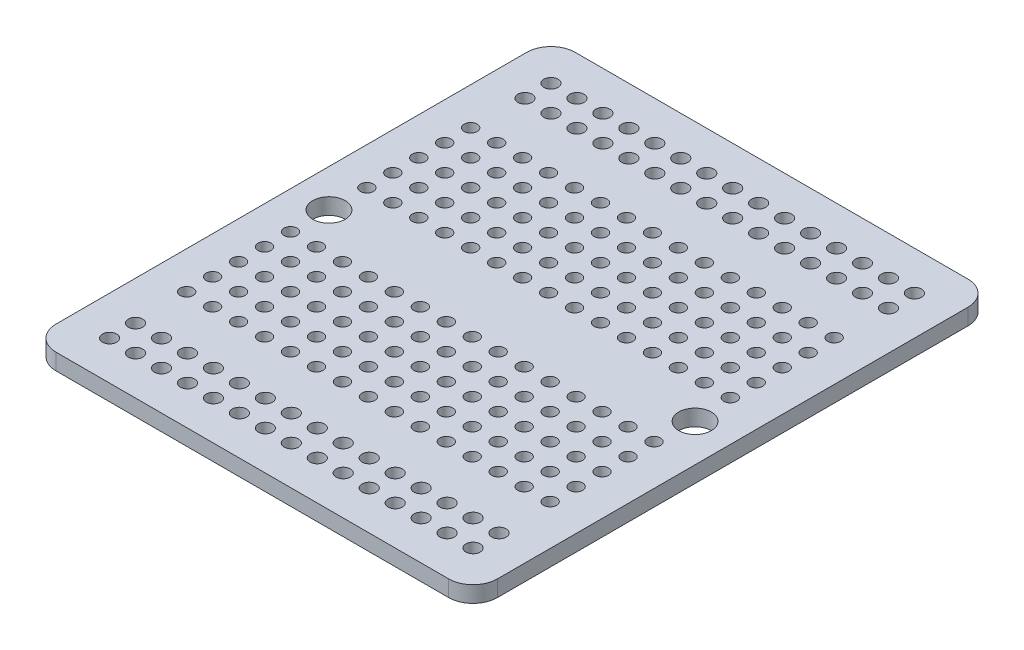
from build123d import *

# Parameters (mm, degrees)
SKETCH1_W                 = 43.18
SKETCH1_H                 = 50.8
BOSS_EXTRUDE1_DEPTH       = 1.5875
FILLET1_R                 = 2.38125
SKETCH4_R                 = 0.6985
CUT_EXTRUDE1_DEPTH        = 34.373765988
LPATTERN1_COUNT           = 15
LPATTERN1_PITCH           = 2.54
LPATTERN1_COUNT_DIR2      = 2
LPATTERN1_PITCH_DIR2      = 2.54
SKETCH5_R                 = 0.635
CUT_EXTRUDE6_DEPTH        = 34.373765988
LPATTERN2_COUNT           = 15
LPATTERN2_PITCH           = 2.54
LPATTERN2_COUNT_DIR2      = 5
LPATTERN2_PITCH_DIR2      = 2.54
MIRROR1_COPY_1_SKETCH_R   = 0.6985
MIRROR1_COPY_1_DEPTH      = 34.373765988
MIRROR1_COPY_2_SKETCH_R   = 0.6985
MIRROR1_COPY_2_DEPTH      = 34.373765988
MIRROR1_COPY_3_SKETCH_R   = 0.6985
MIRROR1_COPY_3_DEPTH      = 34.373765988
MIRROR1_COPY_4_SKETCH_R   = 0.6985
MIRROR1_COPY_4_DEPTH      = 34.373765988
MIRROR1_COPY_5_SKETCH_R   = 0.6985
MIRROR1_COPY_5_DEPTH      = 34.373765988
MIRROR1_COPY_6_SKETCH_R   = 0.6985
MIRROR1_COPY_6_DEPTH      = 34.373765988
MIRROR1_COPY_7_SKETCH_R   = 0.6985
MIRROR1_COPY_7_DEPTH      = 34.373765988
MIRROR1_COPY_8_SKETCH_R   = 0.6985
MIRROR1_COPY_8_DEPTH      = 34.373765988
MIRROR1_COPY_9_SKETCH_R   = 0.6985
MIRROR1_COPY_9_DEPTH      = 34.373765988
MIRROR1_COPY_10_SKETCH_R  = 0.6985
MIRROR1_COPY_10_DEPTH     = 34.373765988
MIRROR1_COPY_11_SKETCH_R  = 0.6985
MIRROR1_COPY_11_DEPTH     = 34.373765988
MIRROR1_COPY_12_SKETCH_R  = 0.6985
MIRROR1_COPY_12_DEPTH     = 34.373765988
MIRROR1_COPY_13_SKETCH_R  = 0.6985
MIRROR1_COPY_13_DEPTH     = 34.373765988
MIRROR1_COPY_14_SKETCH_R  = 0.6985
MIRROR1_COPY_14_DEPTH     = 34.373765988
MIRROR1_COPY_15_SKETCH_R  = 0.6985
MIRROR1_COPY_15_DEPTH     = 34.373765988
MIRROR1_COPY_16_SKETCH_R  = 0.6985
MIRROR1_COPY_16_DEPTH     = 34.373765988
MIRROR1_COPY_17_SKETCH_R  = 0.6985
MIRROR1_COPY_17_DEPTH     = 34.373765988
MIRROR1_COPY_18_SKETCH_R  = 0.6985
MIRROR1_COPY_18_DEPTH     = 34.373765988
MIRROR1_COPY_19_SKETCH_R  = 0.6985
MIRROR1_COPY_19_DEPTH     = 34.373765988
MIRROR1_COPY_20_SKETCH_R  = 0.6985
MIRROR1_COPY_20_DEPTH     = 34.373765988
MIRROR1_COPY_21_SKETCH_R  = 0.6985
MIRROR1_COPY_21_DEPTH     = 34.373765988
MIRROR1_COPY_22_SKETCH_R  = 0.6985
MIRROR1_COPY_22_DEPTH     = 34.373765988
MIRROR1_COPY_23_SKETCH_R  = 0.6985
MIRROR1_COPY_23_DEPTH     = 34.373765988
MIRROR1_COPY_24_SKETCH_R  = 0.6985
MIRROR1_COPY_24_DEPTH     = 34.373765988
MIRROR1_COPY_25_SKETCH_R  = 0.6985
MIRROR1_COPY_25_DEPTH     = 34.373765988
MIRROR1_COPY_26_SKETCH_R  = 0.6985
MIRROR1_COPY_26_DEPTH     = 34.373765988
MIRROR1_COPY_27_SKETCH_R  = 0.6985
MIRROR1_COPY_27_DEPTH     = 34.373765988
MIRROR1_COPY_28_SKETCH_R  = 0.6985
MIRROR1_COPY_28_DEPTH     = 34.373765988
MIRROR1_COPY_29_SKETCH_R  = 0.6985
MIRROR1_COPY_29_DEPTH     = 34.373765988
MIRROR1_COPY_30_SKETCH_R  = 0.635
MIRROR1_COPY_30_DEPTH     = 34.373765988
MIRROR1_COPY_31_SKETCH_R  = 0.635
MIRROR1_COPY_31_DEPTH     = 34.373765988
MIRROR1_COPY_32_SKETCH_R  = 0.635
MIRROR1_COPY_32_DEPTH     = 34.373765988
MIRROR1_COPY_33_SKETCH_R  = 0.635
MIRROR1_COPY_33_DEPTH     = 34.373765988
MIRROR1_COPY_34_SKETCH_R  = 0.635
MIRROR1_COPY_34_DEPTH     = 34.373765988
MIRROR1_COPY_35_SKETCH_R  = 0.635
MIRROR1_COPY_35_DEPTH     = 34.373765988
MIRROR1_COPY_36_SKETCH_R  = 0.635
MIRROR1_COPY_36_DEPTH     = 34.373765988
MIRROR1_COPY_37_SKETCH_R  = 0.635
MIRROR1_COPY_37_DEPTH     = 34.373765988
MIRROR1_COPY_38_SKETCH_R  = 0.635
MIRROR1_COPY_38_DEPTH     = 34.373765988
MIRROR1_COPY_39_SKETCH_R  = 0.635
MIRROR1_COPY_39_DEPTH     = 34.373765988
MIRROR1_COPY_40_SKETCH_R  = 0.635
MIRROR1_COPY_40_DEPTH     = 34.373765988
MIRROR1_COPY_41_SKETCH_R  = 0.635
MIRROR1_COPY_41_DEPTH     = 34.373765988
MIRROR1_COPY_42_SKETCH_R  = 0.635
MIRROR1_COPY_42_DEPTH     = 34.373765988
MIRROR1_COPY_43_SKETCH_R  = 0.635
MIRROR1_COPY_43_DEPTH     = 34.373765988
MIRROR1_COPY_44_SKETCH_R  = 0.635
MIRROR1_COPY_44_DEPTH     = 34.373765988
MIRROR1_COPY_45_SKETCH_R  = 0.635
MIRROR1_COPY_45_DEPTH     = 34.373765988
MIRROR1_COPY_46_SKETCH_R  = 0.635
MIRROR1_COPY_46_DEPTH     = 34.373765988
MIRROR1_COPY_47_SKETCH_R  = 0.635
MIRROR1_COPY_47_DEPTH     = 34.373765988
MIRROR1_COPY_48_SKETCH_R  = 0.635
MIRROR1_COPY_48_DEPTH     = 34.373765988
MIRROR1_COPY_49_SKETCH_R  = 0.635
MIRROR1_COPY_49_DEPTH     = 34.373765988
MIRROR1_COPY_50_SKETCH_R  = 0.635
MIRROR1_COPY_50_DEPTH     = 34.373765988
MIRROR1_COPY_51_SKETCH_R  = 0.635
MIRROR1_COPY_51_DEPTH     = 34.373765988
MIRROR1_COPY_52_SKETCH_R  = 0.635
MIRROR1_COPY_52_DEPTH     = 34.373765988
MIRROR1_COPY_53_SKETCH_R  = 0.635
MIRROR1_COPY_53_DEPTH     = 34.373765988
MIRROR1_COPY_54_SKETCH_R  = 0.635
MIRROR1_COPY_54_DEPTH     = 34.373765988
MIRROR1_COPY_55_SKETCH_R  = 0.635
MIRROR1_COPY_55_DEPTH     = 34.373765988
MIRROR1_COPY_56_SKETCH_R  = 0.635
MIRROR1_COPY_56_DEPTH     = 34.373765988
MIRROR1_COPY_57_SKETCH_R  = 0.635
MIRROR1_COPY_57_DEPTH     = 34.373765988
MIRROR1_COPY_58_SKETCH_R  = 0.635
MIRROR1_COPY_58_DEPTH     = 34.373765988
MIRROR1_COPY_59_SKETCH_R  = 0.635
MIRROR1_COPY_59_DEPTH     = 34.373765988
MIRROR1_COPY_60_SKETCH_R  = 0.635
MIRROR1_COPY_60_DEPTH     = 34.373765988
MIRROR1_COPY_61_SKETCH_R  = 0.635
MIRROR1_COPY_61_DEPTH     = 34.373765988
MIRROR1_COPY_62_SKETCH_R  = 0.635
MIRROR1_COPY_62_DEPTH     = 34.373765988
MIRROR1_COPY_63_SKETCH_R  = 0.635
MIRROR1_COPY_63_DEPTH     = 34.373765988
MIRROR1_COPY_64_SKETCH_R  = 0.635
MIRROR1_COPY_64_DEPTH     = 34.373765988
MIRROR1_COPY_65_SKETCH_R  = 0.635
MIRROR1_COPY_65_DEPTH     = 34.373765988
MIRROR1_COPY_66_SKETCH_R  = 0.635
MIRROR1_COPY_66_DEPTH     = 34.373765988
MIRROR1_COPY_67_SKETCH_R  = 0.635
MIRROR1_COPY_67_DEPTH     = 34.373765988
MIRROR1_COPY_68_SKETCH_R  = 0.635
MIRROR1_COPY_68_DEPTH     = 34.373765988
MIRROR1_COPY_69_SKETCH_R  = 0.635
MIRROR1_COPY_69_DEPTH     = 34.373765988
MIRROR1_COPY_70_SKETCH_R  = 0.635
MIRROR1_COPY_70_DEPTH     = 34.373765988
MIRROR1_COPY_71_SKETCH_R  = 0.635
MIRROR1_COPY_71_DEPTH     = 34.373765988
MIRROR1_COPY_72_SKETCH_R  = 0.635
MIRROR1_COPY_72_DEPTH     = 34.373765988
MIRROR1_COPY_73_SKETCH_R  = 0.635
MIRROR1_COPY_73_DEPTH     = 34.373765988
MIRROR1_COPY_74_SKETCH_R  = 0.635
MIRROR1_COPY_74_DEPTH     = 34.373765988
MIRROR1_COPY_75_SKETCH_R  = 0.635
MIRROR1_COPY_75_DEPTH     = 34.373765988
MIRROR1_COPY_76_SKETCH_R  = 0.635
MIRROR1_COPY_76_DEPTH     = 34.373765988
MIRROR1_COPY_77_SKETCH_R  = 0.635
MIRROR1_COPY_77_DEPTH     = 34.373765988
MIRROR1_COPY_78_SKETCH_R  = 0.635
MIRROR1_COPY_78_DEPTH     = 34.373765988
MIRROR1_COPY_79_SKETCH_R  = 0.635
MIRROR1_COPY_79_DEPTH     = 34.373765988
MIRROR1_COPY_80_SKETCH_R  = 0.635
MIRROR1_COPY_80_DEPTH     = 34.373765988
MIRROR1_COPY_81_SKETCH_R  = 0.635
MIRROR1_COPY_81_DEPTH     = 34.373765988
MIRROR1_COPY_82_SKETCH_R  = 0.635
MIRROR1_COPY_82_DEPTH     = 34.373765988
MIRROR1_COPY_83_SKETCH_R  = 0.635
MIRROR1_COPY_83_DEPTH     = 34.373765988
MIRROR1_COPY_84_SKETCH_R  = 0.635
MIRROR1_COPY_84_DEPTH     = 34.373765988
MIRROR1_COPY_85_SKETCH_R  = 0.635
MIRROR1_COPY_85_DEPTH     = 34.373765988
MIRROR1_COPY_86_SKETCH_R  = 0.635
MIRROR1_COPY_86_DEPTH     = 34.373765988
MIRROR1_COPY_87_SKETCH_R  = 0.635
MIRROR1_COPY_87_DEPTH     = 34.373765988
MIRROR1_COPY_88_SKETCH_R  = 0.635
MIRROR1_COPY_88_DEPTH     = 34.373765988
MIRROR1_COPY_89_SKETCH_R  = 0.635
MIRROR1_COPY_89_DEPTH     = 34.373765988
MIRROR1_COPY_90_SKETCH_R  = 0.635
MIRROR1_COPY_90_DEPTH     = 34.373765988
MIRROR1_COPY_91_SKETCH_R  = 0.635
MIRROR1_COPY_91_DEPTH     = 34.373765988
MIRROR1_COPY_92_SKETCH_R  = 0.635
MIRROR1_COPY_92_DEPTH     = 34.373765988
MIRROR1_COPY_93_SKETCH_R  = 0.635
MIRROR1_COPY_93_DEPTH     = 34.373765988
MIRROR1_COPY_94_SKETCH_R  = 0.635
MIRROR1_COPY_94_DEPTH     = 34.373765988
MIRROR1_COPY_95_SKETCH_R  = 0.635
MIRROR1_COPY_95_DEPTH     = 34.373765988
MIRROR1_COPY_96_SKETCH_R  = 0.635
MIRROR1_COPY_96_DEPTH     = 34.373765988
MIRROR1_COPY_97_SKETCH_R  = 0.635
MIRROR1_COPY_97_DEPTH     = 34.373765988
MIRROR1_COPY_98_SKETCH_R  = 0.635
MIRROR1_COPY_98_DEPTH     = 34.373765988
MIRROR1_COPY_99_SKETCH_R  = 0.635
MIRROR1_COPY_99_DEPTH     = 34.373765988
MIRROR1_COPY_100_SKETCH_R = 0.635
MIRROR1_COPY_100_DEPTH    = 34.373765988
MIRROR1_COPY_101_SKETCH_R = 0.635
MIRROR1_COPY_101_DEPTH    = 34.373765988
MIRROR1_COPY_102_SKETCH_R = 0.635
MIRROR1_COPY_102_DEPTH    = 34.373765988
MIRROR1_COPY_103_SKETCH_R = 0.635
MIRROR1_COPY_103_DEPTH    = 34.373765988
SKETCH6_R                 = 1.5875
CUT_EXTRUDE7_DEPTH        = 34.373765988


with BuildPart() as part:
    # Sketch1 → Boss-Extrude1 (new body)
    with BuildSketch(Plane(origin=(0, 0, 0), x_dir=(1, 0, 0), z_dir=(0, 1, 0))):
        Rectangle(SKETCH1_W, SKETCH1_H)
    extrude(amount=BOSS_EXTRUDE1_DEPTH)

    # Fillet1
    fillet1_edges = [part.edges().sort_by_distance(p)[0] for p in [
        (-21.59, 0.79375, 25.4),
        (-21.59, 0.79375, -25.4),
        (21.59, 0.79375, -25.4),
        (21.59, 0.79375, 25.4),
    ]]
    fillet(fillet1_edges, radius=FILLET1_R)

    # Sketch4 → Cut-Extrude1 (cut, through all)
    with BuildSketch(Plane(origin=(0, 1.5875, 0), x_dir=(1, 0, 0), z_dir=(0, 1, 0))):
        with Locations((-17.78, 21.59)):
            Circle(SKETCH4_R)
    cut_extrude1 = extrude(amount=-CUT_EXTRUDE1_DEPTH, mode=Mode.SUBTRACT)

    # LPattern1: Cut-Extrude1 15 × 2
    with Locations(*[(i * LPATTERN1_PITCH, 0, j * LPATTERN1_PITCH_DIR2) for i in range(LPATTERN1_COUNT) for j in range(LPATTERN1_COUNT_DIR2) if (i, j) != (0, 0)]):
        add(cut_extrude1, mode=Mode.SUBTRACT)

    # Sketch5 → Cut-Extrude6 (cut, through all)
    with BuildSketch(Plane(origin=(0, 0, 0), x_dir=(1, 0, 0), z_dir=(0, 1, 0))):
        with Locations((-17.935079329, 13.893307041)):
            Circle(SKETCH5_R)
    cut_extrude6 = extrude(amount=CUT_EXTRUDE6_DEPTH, mode=Mode.SUBTRACT)

    # LPattern2: Cut-Extrude6 15 × 5
    with Locations(*[(i * LPATTERN2_PITCH, 0, j * LPATTERN2_PITCH_DIR2) for i in range(LPATTERN2_COUNT) for j in range(LPATTERN2_COUNT_DIR2) if (i, j) != (0, 0)]):
        add(cut_extrude6, mode=Mode.SUBTRACT)

    # Mirror1: Cut-Extrude1, Cut-Extrude6 across plane
    add(cut_extrude1.mirror(Plane.XY), mode=Mode.SUBTRACT)
    add(cut_extrude6.mirror(Plane.XY), mode=Mode.SUBTRACT)

    # Mirror1 copy 1 sketch → Mirror1 copy 1 (cut, through all)
    with BuildSketch(Plane(origin=(0, 1.5875, -2.54), x_dir=(1, 0, 0), z_dir=(0, 1, 0))):
        with Locations((-17.78, -21.59)):
            Circle(MIRROR1_COPY_1_SKETCH_R)
    extrude(amount=-MIRROR1_COPY_1_DEPTH, mode=Mode.SUBTRACT)

    # Mirror1 copy 2 sketch → Mirror1 copy 2 (cut, through all)
    with BuildSketch(Plane(origin=(2.54, 1.5875, 0), x_dir=(1, 0, 0), z_dir=(0, 1, 0))):
        with Locations((-17.78, -21.59)):
            Circle(MIRROR1_COPY_2_SKETCH_R)
    extrude(amount=-MIRROR1_COPY_2_DEPTH, mode=Mode.SUBTRACT)

    # Mirror1 copy 3 sketch → Mirror1 copy 3 (cut, through all)
    with BuildSketch(Plane(origin=(2.54, 1.5875, -2.54), x_dir=(1, 0, 0), z_dir=(0, 1, 0))):
        with Locations((-17.78, -21.59)):
            Circle(MIRROR1_COPY_3_SKETCH_R)
    extrude(amount=-MIRROR1_COPY_3_DEPTH, mode=Mode.SUBTRACT)

    # Mirror1 copy 4 sketch → Mirror1 copy 4 (cut, through all)
    with BuildSketch(Plane(origin=(5.08, 1.5875, 0), x_dir=(1, 0, 0), z_dir=(0, 1, 0))):
        with Locations((-17.78, -21.59)):
            Circle(MIRROR1_COPY_4_SKETCH_R)
    extrude(amount=-MIRROR1_COPY_4_DEPTH, mode=Mode.SUBTRACT)

    # Mirror1 copy 5 sketch → Mirror1 copy 5 (cut, through all)
    with BuildSketch(Plane(origin=(5.08, 1.5875, -2.54), x_dir=(1, 0, 0), z_dir=(0, 1, 0))):
        with Locations((-17.78, -21.59)):
            Circle(MIRROR1_COPY_5_SKETCH_R)
    extrude(amount=-MIRROR1_COPY_5_DEPTH, mode=Mode.SUBTRACT)

    # Mirror1 copy 6 sketch → Mirror1 copy 6 (cut, through all)
    with BuildSketch(Plane(origin=(7.62, 1.5875, 0), x_dir=(1, 0, 0), z_dir=(0, 1, 0))):
        with Locations((-17.78, -21.59)):
            Circle(MIRROR1_COPY_6_SKETCH_R)
    extrude(amount=-MIRROR1_COPY_6_DEPTH, mode=Mode.SUBTRACT)

    # Mirror1 copy 7 sketch → Mirror1 copy 7 (cut, through all)
    with BuildSketch(Plane(origin=(7.62, 1.5875, -2.54), x_dir=(1, 0, 0), z_dir=(0, 1, 0))):
        with Locations((-17.78, -21.59)):
            Circle(MIRROR1_COPY_7_SKETCH_R)
    extrude(amount=-MIRROR1_COPY_7_DEPTH, mode=Mode.SUBTRACT)

    # Mirror1 copy 8 sketch → Mirror1 copy 8 (cut, through all)
    with BuildSketch(Plane(origin=(10.16, 1.5875, 0), x_dir=(1, 0, 0), z_dir=(0, 1, 0))):
        with Locations((-17.78, -21.59)):
            Circle(MIRROR1_COPY_8_SKETCH_R)
    extrude(amount=-MIRROR1_COPY_8_DEPTH, mode=Mode.SUBTRACT)

    # Mirror1 copy 9 sketch → Mirror1 copy 9 (cut, through all)
    with BuildSketch(Plane(origin=(10.16, 1.5875, -2.54), x_dir=(1, 0, 0), z_dir=(0, 1, 0))):
        with Locations((-17.78, -21.59)):
            Circle(MIRROR1_COPY_9_SKETCH_R)
    extrude(amount=-MIRROR1_COPY_9_DEPTH, mode=Mode.SUBTRACT)

    # Mirror1 copy 10 sketch → Mirror1 copy 10 (cut, through all)
    with BuildSketch(Plane(origin=(12.7, 1.5875, 0), x_dir=(1, 0, 0), z_dir=(0, 1, 0))):
        with Locations((-17.78, -21.59)):
            Circle(MIRROR1_COPY_10_SKETCH_R)
    extrude(amount=-MIRROR1_COPY_10_DEPTH, mode=Mode.SUBTRACT)

    # Mirror1 copy 11 sketch → Mirror1 copy 11 (cut, through all)
    with BuildSketch(Plane(origin=(12.7, 1.5875, -2.54), x_dir=(1, 0, 0), z_dir=(0, 1, 0))):
        with Locations((-17.78, -21.59)):
            Circle(MIRROR1_COPY_11_SKETCH_R)
    extrude(amount=-MIRROR1_COPY_11_DEPTH, mode=Mode.SUBTRACT)

    # Mirror1 copy 12 sketch → Mirror1 copy 12 (cut, through all)
    with BuildSketch(Plane(origin=(15.24, 1.5875, 0), x_dir=(1, 0, 0), z_dir=(0, 1, 0))):
        with Locations((-17.78, -21.59)):
            Circle(MIRROR1_COPY_12_SKETCH_R)
    extrude(amount=-MIRROR1_COPY_12_DEPTH, mode=Mode.SUBTRACT)

    # Mirror1 copy 13 sketch → Mirror1 copy 13 (cut, through all)
    with BuildSketch(Plane(origin=(15.24, 1.5875, -2.54), x_dir=(1, 0, 0), z_dir=(0, 1, 0))):
        with Locations((-17.78, -21.59)):
            Circle(MIRROR1_COPY_13_SKETCH_R)
    extrude(amount=-MIRROR1_COPY_13_DEPTH, mode=Mode.SUBTRACT)

    # Mirror1 copy 14 sketch → Mirror1 copy 14 (cut, through all)
    with BuildSketch(Plane(origin=(17.78, 1.5875, 0), x_dir=(1, 0, 0), z_dir=(0, 1, 0))):
        with Locations((-17.78, -21.59)):
            Circle(MIRROR1_COPY_14_SKETCH_R)
    extrude(amount=-MIRROR1_COPY_14_DEPTH, mode=Mode.SUBTRACT)

    # Mirror1 copy 15 sketch → Mirror1 copy 15 (cut, through all)
    with BuildSketch(Plane(origin=(17.78, 1.5875, -2.54), x_dir=(1, 0, 0), z_dir=(0, 1, 0))):
        with Locations((-17.78, -21.59)):
            Circle(MIRROR1_COPY_15_SKETCH_R)
    extrude(amount=-MIRROR1_COPY_15_DEPTH, mode=Mode.SUBTRACT)

    # Mirror1 copy 16 sketch → Mirror1 copy 16 (cut, through all)
    with BuildSketch(Plane(origin=(20.32, 1.5875, 0), x_dir=(1, 0, 0), z_dir=(0, 1, 0))):
        with Locations((-17.78, -21.59)):
            Circle(MIRROR1_COPY_16_SKETCH_R)
    extrude(amount=-MIRROR1_COPY_16_DEPTH, mode=Mode.SUBTRACT)

    # Mirror1 copy 17 sketch → Mirror1 copy 17 (cut, through all)
    with BuildSketch(Plane(origin=(20.32, 1.5875, -2.54), x_dir=(1, 0, 0), z_dir=(0, 1, 0))):
        with Locations((-17.78, -21.59)):
            Circle(MIRROR1_COPY_17_SKETCH_R)
    extrude(amount=-MIRROR1_COPY_17_DEPTH, mode=Mode.SUBTRACT)

    # Mirror1 copy 18 sketch → Mirror1 copy 18 (cut, through all)
    with BuildSketch(Plane(origin=(22.86, 1.5875, 0), x_dir=(1, 0, 0), z_dir=(0, 1, 0))):
        with Locations((-17.78, -21.59)):
            Circle(MIRROR1_COPY_18_SKETCH_R)
    extrude(amount=-MIRROR1_COPY_18_DEPTH, mode=Mode.SUBTRACT)

    # Mirror1 copy 19 sketch → Mirror1 copy 19 (cut, through all)
    with BuildSketch(Plane(origin=(22.86, 1.5875, -2.54), x_dir=(1, 0, 0), z_dir=(0, 1, 0))):
        with Locations((-17.78, -21.59)):
            Circle(MIRROR1_COPY_19_SKETCH_R)
    extrude(amount=-MIRROR1_COPY_19_DEPTH, mode=Mode.SUBTRACT)

    # Mirror1 copy 20 sketch → Mirror1 copy 20 (cut, through all)
    with BuildSketch(Plane(origin=(25.4, 1.5875, 0), x_dir=(1, 0, 0), z_dir=(0, 1, 0))):
        with Locations((-17.78, -21.59)):
            Circle(MIRROR1_COPY_20_SKETCH_R)
    extrude(amount=-MIRROR1_COPY_20_DEPTH, mode=Mode.SUBTRACT)

    # Mirror1 copy 21 sketch → Mirror1 copy 21 (cut, through all)
    with BuildSketch(Plane(origin=(25.4, 1.5875, -2.54), x_dir=(1, 0, 0), z_dir=(0, 1, 0))):
        with Locations((-17.78, -21.59)):
            Circle(MIRROR1_COPY_21_SKETCH_R)
    extrude(amount=-MIRROR1_COPY_21_DEPTH, mode=Mode.SUBTRACT)

    # Mirror1 copy 22 sketch → Mirror1 copy 22 (cut, through all)
    with BuildSketch(Plane(origin=(27.94, 1.5875, 0), x_dir=(1, 0, 0), z_dir=(0, 1, 0))):
        with Locations((-17.78, -21.59)):
            Circle(MIRROR1_COPY_22_SKETCH_R)
    extrude(amount=-MIRROR1_COPY_22_DEPTH, mode=Mode.SUBTRACT)

    # Mirror1 copy 23 sketch → Mirror1 copy 23 (cut, through all)
    with BuildSketch(Plane(origin=(27.94, 1.5875, -2.54), x_dir=(1, 0, 0), z_dir=(0, 1, 0))):
        with Locations((-17.78, -21.59)):
            Circle(MIRROR1_COPY_23_SKETCH_R)
    extrude(amount=-MIRROR1_COPY_23_DEPTH, mode=Mode.SUBTRACT)

    # Mirror1 copy 24 sketch → Mirror1 copy 24 (cut, through all)
    with BuildSketch(Plane(origin=(30.48, 1.5875, 0), x_dir=(1, 0, 0), z_dir=(0, 1, 0))):
        with Locations((-17.78, -21.59)):
            Circle(MIRROR1_COPY_24_SKETCH_R)
    extrude(amount=-MIRROR1_COPY_24_DEPTH, mode=Mode.SUBTRACT)

    # Mirror1 copy 25 sketch → Mirror1 copy 25 (cut, through all)
    with BuildSketch(Plane(origin=(30.48, 1.5875, -2.54), x_dir=(1, 0, 0), z_dir=(0, 1, 0))):
        with Locations((-17.78, -21.59)):
            Circle(MIRROR1_COPY_25_SKETCH_R)
    extrude(amount=-MIRROR1_COPY_25_DEPTH, mode=Mode.SUBTRACT)

    # Mirror1 copy 26 sketch → Mirror1 copy 26 (cut, through all)
    with BuildSketch(Plane(origin=(33.02, 1.5875, 0), x_dir=(1, 0, 0), z_dir=(0, 1, 0))):
        with Locations((-17.78, -21.59)):
            Circle(MIRROR1_COPY_26_SKETCH_R)
    extrude(amount=-MIRROR1_COPY_26_DEPTH, mode=Mode.SUBTRACT)

    # Mirror1 copy 27 sketch → Mirror1 copy 27 (cut, through all)
    with BuildSketch(Plane(origin=(33.02, 1.5875, -2.54), x_dir=(1, 0, 0), z_dir=(0, 1, 0))):
        with Locations((-17.78, -21.59)):
            Circle(MIRROR1_COPY_27_SKETCH_R)
    extrude(amount=-MIRROR1_COPY_27_DEPTH, mode=Mode.SUBTRACT)

    # Mirror1 copy 28 sketch → Mirror1 copy 28 (cut, through all)
    with BuildSketch(Plane(origin=(35.56, 1.5875, 0), x_dir=(1, 0, 0), z_dir=(0, 1, 0))):
        with Locations((-17.78, -21.59)):
            Circle(MIRROR1_COPY_28_SKETCH_R)
    extrude(amount=-MIRROR1_COPY_28_DEPTH, mode=Mode.SUBTRACT)

    # Mirror1 copy 29 sketch → Mirror1 copy 29 (cut, through all)
    with BuildSketch(Plane(origin=(35.56, 1.5875, -2.54), x_dir=(1, 0, 0), z_dir=(0, 1, 0))):
        with Locations((-17.78, -21.59)):
            Circle(MIRROR1_COPY_29_SKETCH_R)
    extrude(amount=-MIRROR1_COPY_29_DEPTH, mode=Mode.SUBTRACT)

    # Mirror1 copy 30 sketch → Mirror1 copy 30 (cut, through all)
    with BuildSketch(Plane(origin=(0, 0, -2.54), x_dir=(1, 0, 0), z_dir=(0, 1, 0))):
        with Locations((-17.935079329, -13.893307041)):
            Circle(MIRROR1_COPY_30_SKETCH_R)
    extrude(amount=MIRROR1_COPY_30_DEPTH, mode=Mode.SUBTRACT)

    # Mirror1 copy 31 sketch → Mirror1 copy 31 (cut, through all)
    with BuildSketch(Plane(origin=(0, 0, -5.08), x_dir=(1, 0, 0), z_dir=(0, 1, 0))):
        with Locations((-17.935079329, -13.893307041)):
            Circle(MIRROR1_COPY_31_SKETCH_R)
    extrude(amount=MIRROR1_COPY_31_DEPTH, mode=Mode.SUBTRACT)

    # Mirror1 copy 32 sketch → Mirror1 copy 32 (cut, through all)
    with BuildSketch(Plane(origin=(0, 0, -7.62), x_dir=(1, 0, 0), z_dir=(0, 1, 0))):
        with Locations((-17.935079329, -13.893307041)):
            Circle(MIRROR1_COPY_32_SKETCH_R)
    extrude(amount=MIRROR1_COPY_32_DEPTH, mode=Mode.SUBTRACT)

    # Mirror1 copy 33 sketch → Mirror1 copy 33 (cut, through all)
    with BuildSketch(Plane(origin=(0, 0, -10.16), x_dir=(1, 0, 0), z_dir=(0, 1, 0))):
        with Locations((-17.935079329, -13.893307041)):
            Circle(MIRROR1_COPY_33_SKETCH_R)
    extrude(amount=MIRROR1_COPY_33_DEPTH, mode=Mode.SUBTRACT)

    # Mirror1 copy 34 sketch → Mirror1 copy 34 (cut, through all)
    with BuildSketch(Plane(origin=(2.54, 0, 0), x_dir=(1, 0, 0), z_dir=(0, 1, 0))):
        with Locations((-17.935079329, -13.893307041)):
            Circle(MIRROR1_COPY_34_SKETCH_R)
    extrude(amount=MIRROR1_COPY_34_DEPTH, mode=Mode.SUBTRACT)

    # Mirror1 copy 35 sketch → Mirror1 copy 35 (cut, through all)
    with BuildSketch(Plane(origin=(2.54, 0, -2.54), x_dir=(1, 0, 0), z_dir=(0, 1, 0))):
        with Locations((-17.935079329, -13.893307041)):
            Circle(MIRROR1_COPY_35_SKETCH_R)
    extrude(amount=MIRROR1_COPY_35_DEPTH, mode=Mode.SUBTRACT)

    # Mirror1 copy 36 sketch → Mirror1 copy 36 (cut, through all)
    with BuildSketch(Plane(origin=(2.54, 0, -5.08), x_dir=(1, 0, 0), z_dir=(0, 1, 0))):
        with Locations((-17.935079329, -13.893307041)):
            Circle(MIRROR1_COPY_36_SKETCH_R)
    extrude(amount=MIRROR1_COPY_36_DEPTH, mode=Mode.SUBTRACT)

    # Mirror1 copy 37 sketch → Mirror1 copy 37 (cut, through all)
    with BuildSketch(Plane(origin=(2.54, 0, -7.62), x_dir=(1, 0, 0), z_dir=(0, 1, 0))):
        with Locations((-17.935079329, -13.893307041)):
            Circle(MIRROR1_COPY_37_SKETCH_R)
    extrude(amount=MIRROR1_COPY_37_DEPTH, mode=Mode.SUBTRACT)

    # Mirror1 copy 38 sketch → Mirror1 copy 38 (cut, through all)
    with BuildSketch(Plane(origin=(2.54, 0, -10.16), x_dir=(1, 0, 0), z_dir=(0, 1, 0))):
        with Locations((-17.935079329, -13.893307041)):
            Circle(MIRROR1_COPY_38_SKETCH_R)
    extrude(amount=MIRROR1_COPY_38_DEPTH, mode=Mode.SUBTRACT)

    # Mirror1 copy 39 sketch → Mirror1 copy 39 (cut, through all)
    with BuildSketch(Plane(origin=(5.08, 0, 0), x_dir=(1, 0, 0), z_dir=(0, 1, 0))):
        with Locations((-17.935079329, -13.893307041)):
            Circle(MIRROR1_COPY_39_SKETCH_R)
    extrude(amount=MIRROR1_COPY_39_DEPTH, mode=Mode.SUBTRACT)

    # Mirror1 copy 40 sketch → Mirror1 copy 40 (cut, through all)
    with BuildSketch(Plane(origin=(5.08, 0, -2.54), x_dir=(1, 0, 0), z_dir=(0, 1, 0))):
        with Locations((-17.935079329, -13.893307041)):
            Circle(MIRROR1_COPY_40_SKETCH_R)
    extrude(amount=MIRROR1_COPY_40_DEPTH, mode=Mode.SUBTRACT)

    # Mirror1 copy 41 sketch → Mirror1 copy 41 (cut, through all)
    with BuildSketch(Plane(origin=(5.08, 0, -5.08), x_dir=(1, 0, 0), z_dir=(0, 1, 0))):
        with Locations((-17.935079329, -13.893307041)):
            Circle(MIRROR1_COPY_41_SKETCH_R)
    extrude(amount=MIRROR1_COPY_41_DEPTH, mode=Mode.SUBTRACT)

    # Mirror1 copy 42 sketch → Mirror1 copy 42 (cut, through all)
    with BuildSketch(Plane(origin=(5.08, 0, -7.62), x_dir=(1, 0, 0), z_dir=(0, 1, 0))):
        with Locations((-17.935079329, -13.893307041)):
            Circle(MIRROR1_COPY_42_SKETCH_R)
    extrude(amount=MIRROR1_COPY_42_DEPTH, mode=Mode.SUBTRACT)

    # Mirror1 copy 43 sketch → Mirror1 copy 43 (cut, through all)
    with BuildSketch(Plane(origin=(5.08, 0, -10.16), x_dir=(1, 0, 0), z_dir=(0, 1, 0))):
        with Locations((-17.935079329, -13.893307041)):
            Circle(MIRROR1_COPY_43_SKETCH_R)
    extrude(amount=MIRROR1_COPY_43_DEPTH, mode=Mode.SUBTRACT)

    # Mirror1 copy 44 sketch → Mirror1 copy 44 (cut, through all)
    with BuildSketch(Plane(origin=(7.62, 0, 0), x_dir=(1, 0, 0), z_dir=(0, 1, 0))):
        with Locations((-17.935079329, -13.893307041)):
            Circle(MIRROR1_COPY_44_SKETCH_R)
    extrude(amount=MIRROR1_COPY_44_DEPTH, mode=Mode.SUBTRACT)

    # Mirror1 copy 45 sketch → Mirror1 copy 45 (cut, through all)
    with BuildSketch(Plane(origin=(7.62, 0, -2.54), x_dir=(1, 0, 0), z_dir=(0, 1, 0))):
        with Locations((-17.935079329, -13.893307041)):
            Circle(MIRROR1_COPY_45_SKETCH_R)
    extrude(amount=MIRROR1_COPY_45_DEPTH, mode=Mode.SUBTRACT)

    # Mirror1 copy 46 sketch → Mirror1 copy 46 (cut, through all)
    with BuildSketch(Plane(origin=(7.62, 0, -5.08), x_dir=(1, 0, 0), z_dir=(0, 1, 0))):
        with Locations((-17.935079329, -13.893307041)):
            Circle(MIRROR1_COPY_46_SKETCH_R)
    extrude(amount=MIRROR1_COPY_46_DEPTH, mode=Mode.SUBTRACT)

    # Mirror1 copy 47 sketch → Mirror1 copy 47 (cut, through all)
    with BuildSketch(Plane(origin=(7.62, 0, -7.62), x_dir=(1, 0, 0), z_dir=(0, 1, 0))):
        with Locations((-17.935079329, -13.893307041)):
            Circle(MIRROR1_COPY_47_SKETCH_R)
    extrude(amount=MIRROR1_COPY_47_DEPTH, mode=Mode.SUBTRACT)

    # Mirror1 copy 48 sketch → Mirror1 copy 48 (cut, through all)
    with BuildSketch(Plane(origin=(7.62, 0, -10.16), x_dir=(1, 0, 0), z_dir=(0, 1, 0))):
        with Locations((-17.935079329, -13.893307041)):
            Circle(MIRROR1_COPY_48_SKETCH_R)
    extrude(amount=MIRROR1_COPY_48_DEPTH, mode=Mode.SUBTRACT)

    # Mirror1 copy 49 sketch → Mirror1 copy 49 (cut, through all)
    with BuildSketch(Plane(origin=(10.16, 0, 0), x_dir=(1, 0, 0), z_dir=(0, 1, 0))):
        with Locations((-17.935079329, -13.893307041)):
            Circle(MIRROR1_COPY_49_SKETCH_R)
    extrude(amount=MIRROR1_COPY_49_DEPTH, mode=Mode.SUBTRACT)

    # Mirror1 copy 50 sketch → Mirror1 copy 50 (cut, through all)
    with BuildSketch(Plane(origin=(10.16, 0, -2.54), x_dir=(1, 0, 0), z_dir=(0, 1, 0))):
        with Locations((-17.935079329, -13.893307041)):
            Circle(MIRROR1_COPY_50_SKETCH_R)
    extrude(amount=MIRROR1_COPY_50_DEPTH, mode=Mode.SUBTRACT)

    # Mirror1 copy 51 sketch → Mirror1 copy 51 (cut, through all)
    with BuildSketch(Plane(origin=(10.16, 0, -5.08), x_dir=(1, 0, 0), z_dir=(0, 1, 0))):
        with Locations((-17.935079329, -13.893307041)):
            Circle(MIRROR1_COPY_51_SKETCH_R)
    extrude(amount=MIRROR1_COPY_51_DEPTH, mode=Mode.SUBTRACT)

    # Mirror1 copy 52 sketch → Mirror1 copy 52 (cut, through all)
    with BuildSketch(Plane(origin=(10.16, 0, -7.62), x_dir=(1, 0, 0), z_dir=(0, 1, 0))):
        with Locations((-17.935079329, -13.893307041)):
            Circle(MIRROR1_COPY_52_SKETCH_R)
    extrude(amount=MIRROR1_COPY_52_DEPTH, mode=Mode.SUBTRACT)

    # Mirror1 copy 53 sketch → Mirror1 copy 53 (cut, through all)
    with BuildSketch(Plane(origin=(10.16, 0, -10.16), x_dir=(1, 0, 0), z_dir=(0, 1, 0))):
        with Locations((-17.935079329, -13.893307041)):
            Circle(MIRROR1_COPY_53_SKETCH_R)
    extrude(amount=MIRROR1_COPY_53_DEPTH, mode=Mode.SUBTRACT)

    # Mirror1 copy 54 sketch → Mirror1 copy 54 (cut, through all)
    with BuildSketch(Plane(origin=(12.7, 0, 0), x_dir=(1, 0, 0), z_dir=(0, 1, 0))):
        with Locations((-17.935079329, -13.893307041)):
            Circle(MIRROR1_COPY_54_SKETCH_R)
    extrude(amount=MIRROR1_COPY_54_DEPTH, mode=Mode.SUBTRACT)

    # Mirror1 copy 55 sketch → Mirror1 copy 55 (cut, through all)
    with BuildSketch(Plane(origin=(12.7, 0, -2.54), x_dir=(1, 0, 0), z_dir=(0, 1, 0))):
        with Locations((-17.935079329, -13.893307041)):
            Circle(MIRROR1_COPY_55_SKETCH_R)
    extrude(amount=MIRROR1_COPY_55_DEPTH, mode=Mode.SUBTRACT)

    # Mirror1 copy 56 sketch → Mirror1 copy 56 (cut, through all)
    with BuildSketch(Plane(origin=(12.7, 0, -5.08), x_dir=(1, 0, 0), z_dir=(0, 1, 0))):
        with Locations((-17.935079329, -13.893307041)):
            Circle(MIRROR1_COPY_56_SKETCH_R)
    extrude(amount=MIRROR1_COPY_56_DEPTH, mode=Mode.SUBTRACT)

    # Mirror1 copy 57 sketch → Mirror1 copy 57 (cut, through all)
    with BuildSketch(Plane(origin=(12.7, 0, -7.62), x_dir=(1, 0, 0), z_dir=(0, 1, 0))):
        with Locations((-17.935079329, -13.893307041)):
            Circle(MIRROR1_COPY_57_SKETCH_R)
    extrude(amount=MIRROR1_COPY_57_DEPTH, mode=Mode.SUBTRACT)

    # Mirror1 copy 58 sketch → Mirror1 copy 58 (cut, through all)
    with BuildSketch(Plane(origin=(12.7, 0, -10.16), x_dir=(1, 0, 0), z_dir=(0, 1, 0))):
        with Locations((-17.935079329, -13.893307041)):
            Circle(MIRROR1_COPY_58_SKETCH_R)
    extrude(amount=MIRROR1_COPY_58_DEPTH, mode=Mode.SUBTRACT)

    # Mirror1 copy 59 sketch → Mirror1 copy 59 (cut, through all)
    with BuildSketch(Plane(origin=(15.24, 0, 0), x_dir=(1, 0, 0), z_dir=(0, 1, 0))):
        with Locations((-17.935079329, -13.893307041)):
            Circle(MIRROR1_COPY_59_SKETCH_R)
    extrude(amount=MIRROR1_COPY_59_DEPTH, mode=Mode.SUBTRACT)

    # Mirror1 copy 60 sketch → Mirror1 copy 60 (cut, through all)
    with BuildSketch(Plane(origin=(15.24, 0, -2.54), x_dir=(1, 0, 0), z_dir=(0, 1, 0))):
        with Locations((-17.935079329, -13.893307041)):
            Circle(MIRROR1_COPY_60_SKETCH_R)
    extrude(amount=MIRROR1_COPY_60_DEPTH, mode=Mode.SUBTRACT)

    # Mirror1 copy 61 sketch → Mirror1 copy 61 (cut, through all)
    with BuildSketch(Plane(origin=(15.24, 0, -5.08), x_dir=(1, 0, 0), z_dir=(0, 1, 0))):
        with Locations((-17.935079329, -13.893307041)):
            Circle(MIRROR1_COPY_61_SKETCH_R)
    extrude(amount=MIRROR1_COPY_61_DEPTH, mode=Mode.SUBTRACT)

    # Mirror1 copy 62 sketch → Mirror1 copy 62 (cut, through all)
    with BuildSketch(Plane(origin=(15.24, 0, -7.62), x_dir=(1, 0, 0), z_dir=(0, 1, 0))):
        with Locations((-17.935079329, -13.893307041)):
            Circle(MIRROR1_COPY_62_SKETCH_R)
    extrude(amount=MIRROR1_COPY_62_DEPTH, mode=Mode.SUBTRACT)

    # Mirror1 copy 63 sketch → Mirror1 copy 63 (cut, through all)
    with BuildSketch(Plane(origin=(15.24, 0, -10.16), x_dir=(1, 0, 0), z_dir=(0, 1, 0))):
        with Locations((-17.935079329, -13.893307041)):
            Circle(MIRROR1_COPY_63_SKETCH_R)
    extrude(amount=MIRROR1_COPY_63_DEPTH, mode=Mode.SUBTRACT)

    # Mirror1 copy 64 sketch → Mirror1 copy 64 (cut, through all)
    with BuildSketch(Plane(origin=(17.78, 0, 0), x_dir=(1, 0, 0), z_dir=(0, 1, 0))):
        with Locations((-17.935079329, -13.893307041)):
            Circle(MIRROR1_COPY_64_SKETCH_R)
    extrude(amount=MIRROR1_COPY_64_DEPTH, mode=Mode.SUBTRACT)

    # Mirror1 copy 65 sketch → Mirror1 copy 65 (cut, through all)
    with BuildSketch(Plane(origin=(17.78, 0, -2.54), x_dir=(1, 0, 0), z_dir=(0, 1, 0))):
        with Locations((-17.935079329, -13.893307041)):
            Circle(MIRROR1_COPY_65_SKETCH_R)
    extrude(amount=MIRROR1_COPY_65_DEPTH, mode=Mode.SUBTRACT)

    # Mirror1 copy 66 sketch → Mirror1 copy 66 (cut, through all)
    with BuildSketch(Plane(origin=(17.78, 0, -5.08), x_dir=(1, 0, 0), z_dir=(0, 1, 0))):
        with Locations((-17.935079329, -13.893307041)):
            Circle(MIRROR1_COPY_66_SKETCH_R)
    extrude(amount=MIRROR1_COPY_66_DEPTH, mode=Mode.SUBTRACT)

    # Mirror1 copy 67 sketch → Mirror1 copy 67 (cut, through all)
    with BuildSketch(Plane(origin=(17.78, 0, -7.62), x_dir=(1, 0, 0), z_dir=(0, 1, 0))):
        with Locations((-17.935079329, -13.893307041)):
            Circle(MIRROR1_COPY_67_SKETCH_R)
    extrude(amount=MIRROR1_COPY_67_DEPTH, mode=Mode.SUBTRACT)

    # Mirror1 copy 68 sketch → Mirror1 copy 68 (cut, through all)
    with BuildSketch(Plane(origin=(17.78, 0, -10.16), x_dir=(1, 0, 0), z_dir=(0, 1, 0))):
        with Locations((-17.935079329, -13.893307041)):
            Circle(MIRROR1_COPY_68_SKETCH_R)
    extrude(amount=MIRROR1_COPY_68_DEPTH, mode=Mode.SUBTRACT)

    # Mirror1 copy 69 sketch → Mirror1 copy 69 (cut, through all)
    with BuildSketch(Plane(origin=(20.32, 0, 0), x_dir=(1, 0, 0), z_dir=(0, 1, 0))):
        with Locations((-17.935079329, -13.893307041)):
            Circle(MIRROR1_COPY_69_SKETCH_R)
    extrude(amount=MIRROR1_COPY_69_DEPTH, mode=Mode.SUBTRACT)

    # Mirror1 copy 70 sketch → Mirror1 copy 70 (cut, through all)
    with BuildSketch(Plane(origin=(20.32, 0, -2.54), x_dir=(1, 0, 0), z_dir=(0, 1, 0))):
        with Locations((-17.935079329, -13.893307041)):
            Circle(MIRROR1_COPY_70_SKETCH_R)
    extrude(amount=MIRROR1_COPY_70_DEPTH, mode=Mode.SUBTRACT)

    # Mirror1 copy 71 sketch → Mirror1 copy 71 (cut, through all)
    with BuildSketch(Plane(origin=(20.32, 0, -5.08), x_dir=(1, 0, 0), z_dir=(0, 1, 0))):
        with Locations((-17.935079329, -13.893307041)):
            Circle(MIRROR1_COPY_71_SKETCH_R)
    extrude(amount=MIRROR1_COPY_71_DEPTH, mode=Mode.SUBTRACT)

    # Mirror1 copy 72 sketch → Mirror1 copy 72 (cut, through all)
    with BuildSketch(Plane(origin=(20.32, 0, -7.62), x_dir=(1, 0, 0), z_dir=(0, 1, 0))):
        with Locations((-17.935079329, -13.893307041)):
            Circle(MIRROR1_COPY_72_SKETCH_R)
    extrude(amount=MIRROR1_COPY_72_DEPTH, mode=Mode.SUBTRACT)

    # Mirror1 copy 73 sketch → Mirror1 copy 73 (cut, through all)
    with BuildSketch(Plane(origin=(20.32, 0, -10.16), x_dir=(1, 0, 0), z_dir=(0, 1, 0))):
        with Locations((-17.935079329, -13.893307041)):
            Circle(MIRROR1_COPY_73_SKETCH_R)
    extrude(amount=MIRROR1_COPY_73_DEPTH, mode=Mode.SUBTRACT)

    # Mirror1 copy 74 sketch → Mirror1 copy 74 (cut, through all)
    with BuildSketch(Plane(origin=(22.86, 0, 0), x_dir=(1, 0, 0), z_dir=(0, 1, 0))):
        with Locations((-17.935079329, -13.893307041)):
            Circle(MIRROR1_COPY_74_SKETCH_R)
    extrude(amount=MIRROR1_COPY_74_DEPTH, mode=Mode.SUBTRACT)

    # Mirror1 copy 75 sketch → Mirror1 copy 75 (cut, through all)
    with BuildSketch(Plane(origin=(22.86, 0, -2.54), x_dir=(1, 0, 0), z_dir=(0, 1, 0))):
        with Locations((-17.935079329, -13.893307041)):
            Circle(MIRROR1_COPY_75_SKETCH_R)
    extrude(amount=MIRROR1_COPY_75_DEPTH, mode=Mode.SUBTRACT)

    # Mirror1 copy 76 sketch → Mirror1 copy 76 (cut, through all)
    with BuildSketch(Plane(origin=(22.86, 0, -5.08), x_dir=(1, 0, 0), z_dir=(0, 1, 0))):
        with Locations((-17.935079329, -13.893307041)):
            Circle(MIRROR1_COPY_76_SKETCH_R)
    extrude(amount=MIRROR1_COPY_76_DEPTH, mode=Mode.SUBTRACT)

    # Mirror1 copy 77 sketch → Mirror1 copy 77 (cut, through all)
    with BuildSketch(Plane(origin=(22.86, 0, -7.62), x_dir=(1, 0, 0), z_dir=(0, 1, 0))):
        with Locations((-17.935079329, -13.893307041)):
            Circle(MIRROR1_COPY_77_SKETCH_R)
    extrude(amount=MIRROR1_COPY_77_DEPTH, mode=Mode.SUBTRACT)

    # Mirror1 copy 78 sketch → Mirror1 copy 78 (cut, through all)
    with BuildSketch(Plane(origin=(22.86, 0, -10.16), x_dir=(1, 0, 0), z_dir=(0, 1, 0))):
        with Locations((-17.935079329, -13.893307041)):
            Circle(MIRROR1_COPY_78_SKETCH_R)
    extrude(amount=MIRROR1_COPY_78_DEPTH, mode=Mode.SUBTRACT)

    # Mirror1 copy 79 sketch → Mirror1 copy 79 (cut, through all)
    with BuildSketch(Plane(origin=(25.4, 0, 0), x_dir=(1, 0, 0), z_dir=(0, 1, 0))):
        with Locations((-17.935079329, -13.893307041)):
            Circle(MIRROR1_COPY_79_SKETCH_R)
    extrude(amount=MIRROR1_COPY_79_DEPTH, mode=Mode.SUBTRACT)

    # Mirror1 copy 80 sketch → Mirror1 copy 80 (cut, through all)
    with BuildSketch(Plane(origin=(25.4, 0, -2.54), x_dir=(1, 0, 0), z_dir=(0, 1, 0))):
        with Locations((-17.935079329, -13.893307041)):
            Circle(MIRROR1_COPY_80_SKETCH_R)
    extrude(amount=MIRROR1_COPY_80_DEPTH, mode=Mode.SUBTRACT)

    # Mirror1 copy 81 sketch → Mirror1 copy 81 (cut, through all)
    with BuildSketch(Plane(origin=(25.4, 0, -5.08), x_dir=(1, 0, 0), z_dir=(0, 1, 0))):
        with Locations((-17.935079329, -13.893307041)):
            Circle(MIRROR1_COPY_81_SKETCH_R)
    extrude(amount=MIRROR1_COPY_81_DEPTH, mode=Mode.SUBTRACT)

    # Mirror1 copy 82 sketch → Mirror1 copy 82 (cut, through all)
    with BuildSketch(Plane(origin=(25.4, 0, -7.62), x_dir=(1, 0, 0), z_dir=(0, 1, 0))):
        with Locations((-17.935079329, -13.893307041)):
            Circle(MIRROR1_COPY_82_SKETCH_R)
    extrude(amount=MIRROR1_COPY_82_DEPTH, mode=Mode.SUBTRACT)

    # Mirror1 copy 83 sketch → Mirror1 copy 83 (cut, through all)
    with BuildSketch(Plane(origin=(25.4, 0, -10.16), x_dir=(1, 0, 0), z_dir=(0, 1, 0))):
        with Locations((-17.935079329, -13.893307041)):
            Circle(MIRROR1_COPY_83_SKETCH_R)
    extrude(amount=MIRROR1_COPY_83_DEPTH, mode=Mode.SUBTRACT)

    # Mirror1 copy 84 sketch → Mirror1 copy 84 (cut, through all)
    with BuildSketch(Plane(origin=(27.94, 0, 0), x_dir=(1, 0, 0), z_dir=(0, 1, 0))):
        with Locations((-17.935079329, -13.893307041)):
            Circle(MIRROR1_COPY_84_SKETCH_R)
    extrude(amount=MIRROR1_COPY_84_DEPTH, mode=Mode.SUBTRACT)

    # Mirror1 copy 85 sketch → Mirror1 copy 85 (cut, through all)
    with BuildSketch(Plane(origin=(27.94, 0, -2.54), x_dir=(1, 0, 0), z_dir=(0, 1, 0))):
        with Locations((-17.935079329, -13.893307041)):
            Circle(MIRROR1_COPY_85_SKETCH_R)
    extrude(amount=MIRROR1_COPY_85_DEPTH, mode=Mode.SUBTRACT)

    # Mirror1 copy 86 sketch → Mirror1 copy 86 (cut, through all)
    with BuildSketch(Plane(origin=(27.94, 0, -5.08), x_dir=(1, 0, 0), z_dir=(0, 1, 0))):
        with Locations((-17.935079329, -13.893307041)):
            Circle(MIRROR1_COPY_86_SKETCH_R)
    extrude(amount=MIRROR1_COPY_86_DEPTH, mode=Mode.SUBTRACT)

    # Mirror1 copy 87 sketch → Mirror1 copy 87 (cut, through all)
    with BuildSketch(Plane(origin=(27.94, 0, -7.62), x_dir=(1, 0, 0), z_dir=(0, 1, 0))):
        with Locations((-17.935079329, -13.893307041)):
            Circle(MIRROR1_COPY_87_SKETCH_R)
    extrude(amount=MIRROR1_COPY_87_DEPTH, mode=Mode.SUBTRACT)

    # Mirror1 copy 88 sketch → Mirror1 copy 88 (cut, through all)
    with BuildSketch(Plane(origin=(27.94, 0, -10.16), x_dir=(1, 0, 0), z_dir=(0, 1, 0))):
        with Locations((-17.935079329, -13.893307041)):
            Circle(MIRROR1_COPY_88_SKETCH_R)
    extrude(amount=MIRROR1_COPY_88_DEPTH, mode=Mode.SUBTRACT)

    # Mirror1 copy 89 sketch → Mirror1 copy 89 (cut, through all)
    with BuildSketch(Plane(origin=(30.48, 0, 0), x_dir=(1, 0, 0), z_dir=(0, 1, 0))):
        with Locations((-17.935079329, -13.893307041)):
            Circle(MIRROR1_COPY_89_SKETCH_R)
    extrude(amount=MIRROR1_COPY_89_DEPTH, mode=Mode.SUBTRACT)

    # Mirror1 copy 90 sketch → Mirror1 copy 90 (cut, through all)
    with BuildSketch(Plane(origin=(30.48, 0, -2.54), x_dir=(1, 0, 0), z_dir=(0, 1, 0))):
        with Locations((-17.935079329, -13.893307041)):
            Circle(MIRROR1_COPY_90_SKETCH_R)
    extrude(amount=MIRROR1_COPY_90_DEPTH, mode=Mode.SUBTRACT)

    # Mirror1 copy 91 sketch → Mirror1 copy 91 (cut, through all)
    with BuildSketch(Plane(origin=(30.48, 0, -5.08), x_dir=(1, 0, 0), z_dir=(0, 1, 0))):
        with Locations((-17.935079329, -13.893307041)):
            Circle(MIRROR1_COPY_91_SKETCH_R)
    extrude(amount=MIRROR1_COPY_91_DEPTH, mode=Mode.SUBTRACT)

    # Mirror1 copy 92 sketch → Mirror1 copy 92 (cut, through all)
    with BuildSketch(Plane(origin=(30.48, 0, -7.62), x_dir=(1, 0, 0), z_dir=(0, 1, 0))):
        with Locations((-17.935079329, -13.893307041)):
            Circle(MIRROR1_COPY_92_SKETCH_R)
    extrude(amount=MIRROR1_COPY_92_DEPTH, mode=Mode.SUBTRACT)

    # Mirror1 copy 93 sketch → Mirror1 copy 93 (cut, through all)
    with BuildSketch(Plane(origin=(30.48, 0, -10.16), x_dir=(1, 0, 0), z_dir=(0, 1, 0))):
        with Locations((-17.935079329, -13.893307041)):
            Circle(MIRROR1_COPY_93_SKETCH_R)
    extrude(amount=MIRROR1_COPY_93_DEPTH, mode=Mode.SUBTRACT)

    # Mirror1 copy 94 sketch → Mirror1 copy 94 (cut, through all)
    with BuildSketch(Plane(origin=(33.02, 0, 0), x_dir=(1, 0, 0), z_dir=(0, 1, 0))):
        with Locations((-17.935079329, -13.893307041)):
            Circle(MIRROR1_COPY_94_SKETCH_R)
    extrude(amount=MIRROR1_COPY_94_DEPTH, mode=Mode.SUBTRACT)

    # Mirror1 copy 95 sketch → Mirror1 copy 95 (cut, through all)
    with BuildSketch(Plane(origin=(33.02, 0, -2.54), x_dir=(1, 0, 0), z_dir=(0, 1, 0))):
        with Locations((-17.935079329, -13.893307041)):
            Circle(MIRROR1_COPY_95_SKETCH_R)
    extrude(amount=MIRROR1_COPY_95_DEPTH, mode=Mode.SUBTRACT)

    # Mirror1 copy 96 sketch → Mirror1 copy 96 (cut, through all)
    with BuildSketch(Plane(origin=(33.02, 0, -5.08), x_dir=(1, 0, 0), z_dir=(0, 1, 0))):
        with Locations((-17.935079329, -13.893307041)):
            Circle(MIRROR1_COPY_96_SKETCH_R)
    extrude(amount=MIRROR1_COPY_96_DEPTH, mode=Mode.SUBTRACT)

    # Mirror1 copy 97 sketch → Mirror1 copy 97 (cut, through all)
    with BuildSketch(Plane(origin=(33.02, 0, -7.62), x_dir=(1, 0, 0), z_dir=(0, 1, 0))):
        with Locations((-17.935079329, -13.893307041)):
            Circle(MIRROR1_COPY_97_SKETCH_R)
    extrude(amount=MIRROR1_COPY_97_DEPTH, mode=Mode.SUBTRACT)

    # Mirror1 copy 98 sketch → Mirror1 copy 98 (cut, through all)
    with BuildSketch(Plane(origin=(33.02, 0, -10.16), x_dir=(1, 0, 0), z_dir=(0, 1, 0))):
        with Locations((-17.935079329, -13.893307041)):
            Circle(MIRROR1_COPY_98_SKETCH_R)
    extrude(amount=MIRROR1_COPY_98_DEPTH, mode=Mode.SUBTRACT)

    # Mirror1 copy 99 sketch → Mirror1 copy 99 (cut, through all)
    with BuildSketch(Plane(origin=(35.56, 0, 0), x_dir=(1, 0, 0), z_dir=(0, 1, 0))):
        with Locations((-17.935079329, -13.893307041)):
            Circle(MIRROR1_COPY_99_SKETCH_R)
    extrude(amount=MIRROR1_COPY_99_DEPTH, mode=Mode.SUBTRACT)

    # Mirror1 copy 100 sketch → Mirror1 copy 100 (cut, through all)
    with BuildSketch(Plane(origin=(35.56, 0, -2.54), x_dir=(1, 0, 0), z_dir=(0, 1, 0))):
        with Locations((-17.935079329, -13.893307041)):
            Circle(MIRROR1_COPY_100_SKETCH_R)
    extrude(amount=MIRROR1_COPY_100_DEPTH, mode=Mode.SUBTRACT)

    # Mirror1 copy 101 sketch → Mirror1 copy 101 (cut, through all)
    with BuildSketch(Plane(origin=(35.56, 0, -5.08), x_dir=(1, 0, 0), z_dir=(0, 1, 0))):
        with Locations((-17.935079329, -13.893307041)):
            Circle(MIRROR1_COPY_101_SKETCH_R)
    extrude(amount=MIRROR1_COPY_101_DEPTH, mode=Mode.SUBTRACT)

    # Mirror1 copy 102 sketch → Mirror1 copy 102 (cut, through all)
    with BuildSketch(Plane(origin=(35.56, 0, -7.62), x_dir=(1, 0, 0), z_dir=(0, 1, 0))):
        with Locations((-17.935079329, -13.893307041)):
            Circle(MIRROR1_COPY_102_SKETCH_R)
    extrude(amount=MIRROR1_COPY_102_DEPTH, mode=Mode.SUBTRACT)

    # Mirror1 copy 103 sketch → Mirror1 copy 103 (cut, through all)
    with BuildSketch(Plane(origin=(35.56, 0, -10.16), x_dir=(1, 0, 0), z_dir=(0, 1, 0))):
        with Locations((-17.935079329, -13.893307041)):
            Circle(MIRROR1_COPY_103_SKETCH_R)
    extrude(amount=MIRROR1_COPY_103_DEPTH, mode=Mode.SUBTRACT)

    # Sketch6 → Cut-Extrude7 (cut, through all)
    with BuildSketch(Plane(origin=(0, 1.5875, 0), x_dir=(1, 0, 0), z_dir=(0, 1, 0))):
        with Locations((-17.907, 0)):
            Circle(SKETCH6_R)
    cut_extrude7 = extrude(amount=-CUT_EXTRUDE7_DEPTH, mode=Mode.SUBTRACT)

    # Mirror2: Cut-Extrude7 across plane
    add(cut_extrude7.mirror(Plane(origin=(0, 0, 0), x_dir=(0, 0, 1), z_dir=(1, 0, 0))), mode=Mode.SUBTRACT)


solid = part.part
